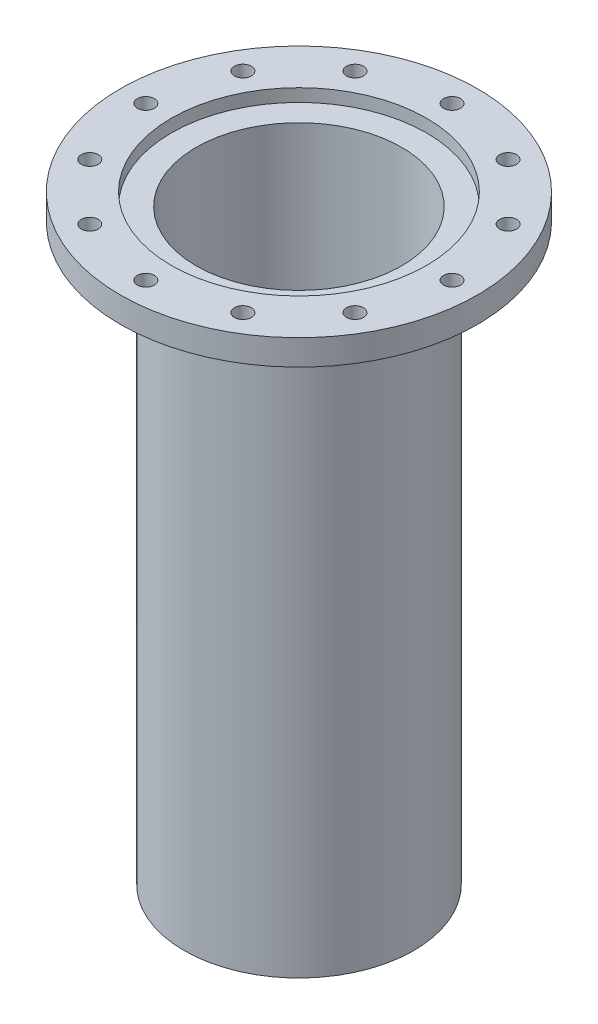
from build123d import *

# Parameters (mm, degrees)
F_5_16_CLEARANCE_HOLE1_D = 8.4328
CIRPATTERN1_COUNT        = 12


with BuildPart() as part:
    # Sketch1 → Revolve1 (revolve)
    with BuildSketch(Plane.XY):
        Polygon((-63.5, 0), (-88.9, 0), (-88.9, -12.7), (-57.15, -12.7), (-57.15, -298.45), (-51.1302, -298.45), (-51.1302, -6.35), (-63.5, -6.35), align=None)
    revolve(axis=Axis((0, 0, 0), (0, -1, 0)))

    # 5/16 Clearance Hole1 (through all)
    with Locations(Plane(origin=(0, 0, 0), x_dir=(1, 0, 0), z_dir=(0, 1, 0))):
        with Locations((-76.2, 0)):
            f_5_16_clearance_hole1 = Hole(F_5_16_CLEARANCE_HOLE1_D / 2)

    # CirPattern1: 5/16 Clearance Hole1 ×12 about axis
    cirpattern1_axis = Axis((0, 0, 0), (0, 1, 0))
    for i in range(1, CIRPATTERN1_COUNT):
        add(f_5_16_clearance_hole1.rotate(cirpattern1_axis, i * 360 / CIRPATTERN1_COUNT), mode=Mode.SUBTRACT)


solid = part.part
